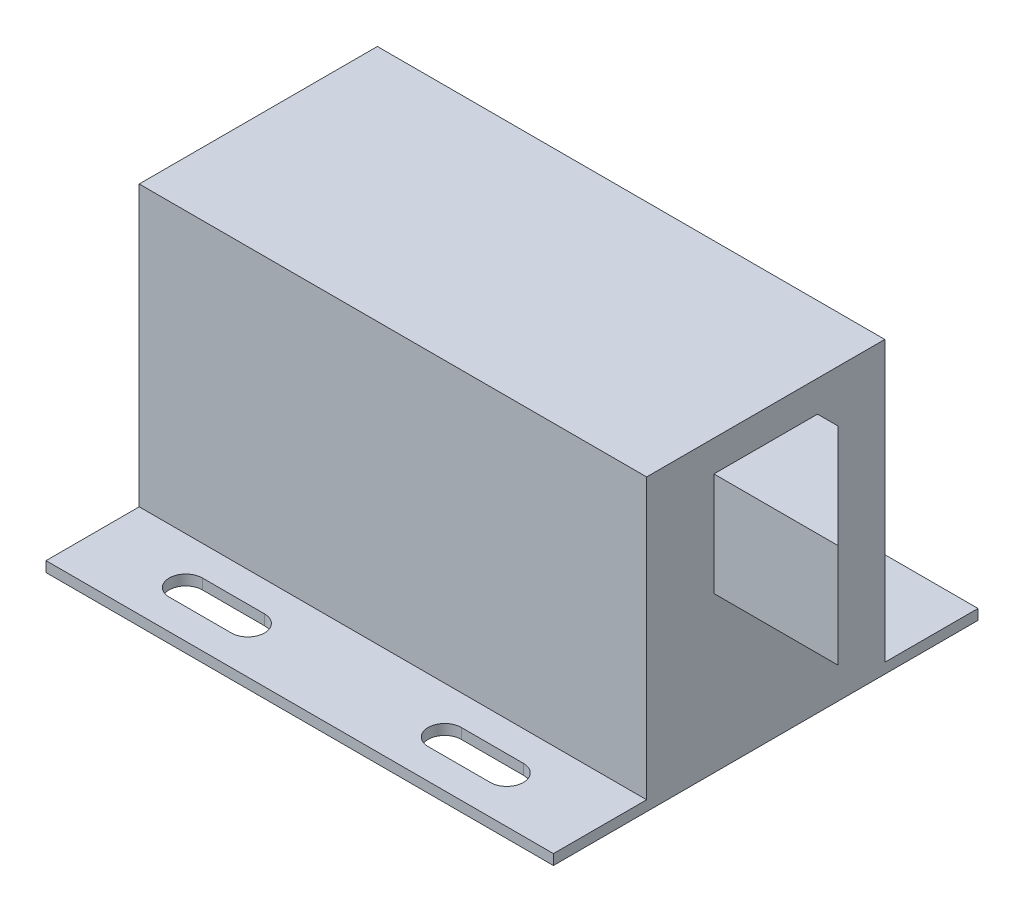
from build123d import *

# Parameters (mm, degrees)
SKETCH1_W           = 49
SKETCH1_H           = 41
BOSS_EXTRUDE1_DEPTH = 1
SKETCH2_W           = 49
SKETCH2_H           = 23
BOSS_EXTRUDE2_DEPTH = 27
SKETCH3_W           = 10
SKETCH3_H           = 10
BOSS_EXTRUDE3_DEPTH = 12
CHAMFER1_SIZE       = 10


with BuildPart() as part:
    # Sketch1 → Boss-Extrude1 (new body)
    with BuildSketch(Plane(origin=(0, 0, 0), x_dir=(1, 0, 0), z_dir=(0, 1, 0))):
        with Locations((24.5, 20.5)):
            Rectangle(SKETCH1_W, SKETCH1_H)
        with BuildLine():
            Line((9, 38.1), (15, 38.1))
            ThreePointArc((15, 38.1), (16.6, 36.5), (15, 34.9))
            Line((15, 34.9), (9, 34.9))
            ThreePointArc((9, 34.9), (7.4, 36.5), (9, 38.1))
        make_face(mode=Mode.SUBTRACT)
        with BuildLine():
            Line((34, 38.1), (40, 38.1))
            ThreePointArc((40, 38.1), (41.6, 36.5), (40, 34.9))
            Line((40, 34.9), (34, 34.9))
            ThreePointArc((34, 34.9), (32.4, 36.5), (34, 38.1))
        make_face(mode=Mode.SUBTRACT)
        with BuildLine():
            Line((34, 6.1), (40, 6.1))
            ThreePointArc((40, 6.1), (41.6, 4.5), (40, 2.9))
            Line((40, 2.9), (34, 2.9))
            ThreePointArc((34, 2.9), (32.4, 4.5), (34, 6.1))
        make_face(mode=Mode.SUBTRACT)
        with BuildLine():
            Line((15, 2.9), (9, 2.9))
            ThreePointArc((9, 2.9), (7.4, 4.5), (9, 6.1))
            Line((9, 6.1), (15, 6.1))
            ThreePointArc((15, 6.1), (16.6, 4.5), (15, 2.9))
        make_face(mode=Mode.SUBTRACT)
    extrude(amount=BOSS_EXTRUDE1_DEPTH)

    # Sketch2 → Boss-Extrude2 (add)
    with BuildSketch(Plane(origin=(0, 1, 0), x_dir=(1, 0, 0), z_dir=(0, 1, 0))):
        with Locations((24.5, 20.5)):
            Rectangle(SKETCH2_W, SKETCH2_H)
    extrude(amount=BOSS_EXTRUDE2_DEPTH)

    # Sketch3 → Boss-Extrude3 (add)
    with BuildSketch(Plane(origin=(49, 0, 0), x_dir=(0, 0, -1), z_dir=(1, 0, 0))):
        with Locations((20.5, 20)):
            Rectangle(SKETCH3_W, SKETCH3_H)
    extrude(amount=BOSS_EXTRUDE3_DEPTH)

    # Chamfer1
    chamfer1_edges = [part.edges().sort_by_distance(p)[0] for p in [
        (61, 20, -25.5),
    ]]
    chamfer(chamfer1_edges, length=CHAMFER1_SIZE - 0.0001)  # a hair under: the kernel refuses the full size


solid = part.part
